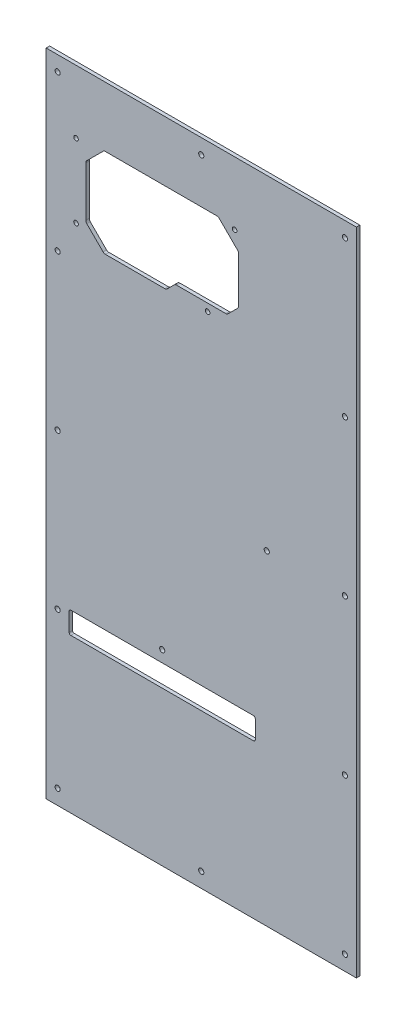
from build123d import *

# Parameters (mm, degrees)
SKETCH_1_W          = 270
SKETCH_1_H          = 566
SKETCH_1_R          = 2.25
EXTRUDE_1_DEPTH     = 3
SKETCH_2_R          = 2
CUT_EXTRUDE_1_DEPTH = 628.108443573
SKETCH_3_W          = 162
SKETCH_3_H          = 19
CUT_EXTRUDE_2_DEPTH = 628.108443573
SKETCH3_R           = 2.25
CUT_EXTRUDE1_DEPTH  = 628.108443573
FILLET1_R           = 3
FILLET2_R           = 1.5


with BuildPart() as part:
    # Эскиз1 → Бобышка-Вытянуть1 (new body)
    with BuildSketch(Plane.XY):
        with Locations((135, 283)):
            Rectangle(SKETCH_1_W, SKETCH_1_H)
        with Locations((10, 553)):
            Circle(SKETCH_1_R, mode=Mode.SUBTRACT)
        with Locations((10, 418)):
            Circle(SKETCH_1_R, mode=Mode.SUBTRACT)
        with Locations((10, 283)):
            Circle(SKETCH_1_R, mode=Mode.SUBTRACT)
        with Locations((10, 148)):
            Circle(SKETCH_1_R, mode=Mode.SUBTRACT)
        with Locations((10, 13)):
            Circle(SKETCH_1_R, mode=Mode.SUBTRACT)
        with Locations((260, 13)):
            Circle(SKETCH_1_R, mode=Mode.SUBTRACT)
        with Locations((135, 553)):
            Circle(SKETCH_1_R, mode=Mode.SUBTRACT)
        with Locations((260, 553)):
            Circle(SKETCH_1_R, mode=Mode.SUBTRACT)
        with Locations((260, 418)):
            Circle(SKETCH_1_R, mode=Mode.SUBTRACT)
        with Locations((260, 283)):
            Circle(SKETCH_1_R, mode=Mode.SUBTRACT)
        with Locations((260, 148)):
            Circle(SKETCH_1_R, mode=Mode.SUBTRACT)
        with Locations((135, 13)):
            Circle(SKETCH_1_R, mode=Mode.SUBTRACT)
    extrude(amount=EXTRUDE_1_DEPTH)

    # Эскиз2 → Вырез-Вытянуть1 (cut, through all)
    with BuildSketch(Plane(origin=(0, 0, 0), x_dir=(-1, 0, 0), z_dir=(0, 0, -1))):
        with Locations((-26, 511)):
            Circle(SKETCH_2_R)
        with Locations((-26, 447)):
            Circle(SKETCH_2_R)
        with Locations((-164, 511)):
            Circle(SKETCH_2_R)
        with Locations((-140.5, 437.5)):
            Circle(SKETCH_2_R)
        Polygon((-50.371243478, 513.75), (-149.75, 513.75), (-167.5, 496), (-167.5, 454), (-157.5, 444), (-112.25, 444), (-104.5, 436.25), (-50.371243478, 436.25), (-34.5, 452.121243478), (-34.5, 497.878756522), align=None)
    extrude(amount=-CUT_EXTRUDE_1_DEPTH, mode=Mode.SUBTRACT)

    # Эскиз3 → Вырез-Вытянуть2 (cut, through all)
    with BuildSketch(Plane(origin=(0, 0, 0), x_dir=(-1, 0, 0), z_dir=(0, 0, -1))):
        with Locations((-101, 143.5)):
            Rectangle(SKETCH_3_W, SKETCH_3_H)
    extrude(amount=-CUT_EXTRUDE_2_DEPTH, mode=Mode.SUBTRACT)

    # Sketch3 → Cut-Extrude1 (cut, through all)
    with BuildSketch(Plane(origin=(0, 0, 0), x_dir=(-1, 0, 0), z_dir=(0, 0, -1))):
        with Locations((-101, 163)):
            Circle(SKETCH3_R)
        with Locations((-192, 283)):
            Circle(SKETCH3_R)
    extrude(amount=-CUT_EXTRUDE1_DEPTH, mode=Mode.SUBTRACT)

    # Fillet1
    fillet1_edges = [part.edges().sort_by_distance(p)[0] for p in [
        (50.371243478, 513.75, 1.5),
        (34.5, 497.878756522, 1.5),
        (34.5, 452.121243478, 1.5),
        (50.371243478, 436.25, 1.5),
        (104.5, 436.25, 1.5),
        (112.25, 444, 1.5),
        (157.5, 444, 1.5),
        (167.5, 454, 1.5),
        (167.5, 496, 1.5),
        (149.75, 513.75, 1.5),
    ]]
    fillet(fillet1_edges, radius=FILLET1_R)

    # Fillet2
    fillet2_edges = [part.edges().sort_by_distance(p)[0] for p in [
        (20, 134, 1.5),
        (20, 153, 1.5),
        (182, 134, 1.5),
        (182, 153, 1.5),
    ]]
    fillet(fillet2_edges, radius=FILLET2_R)


solid = part.part
